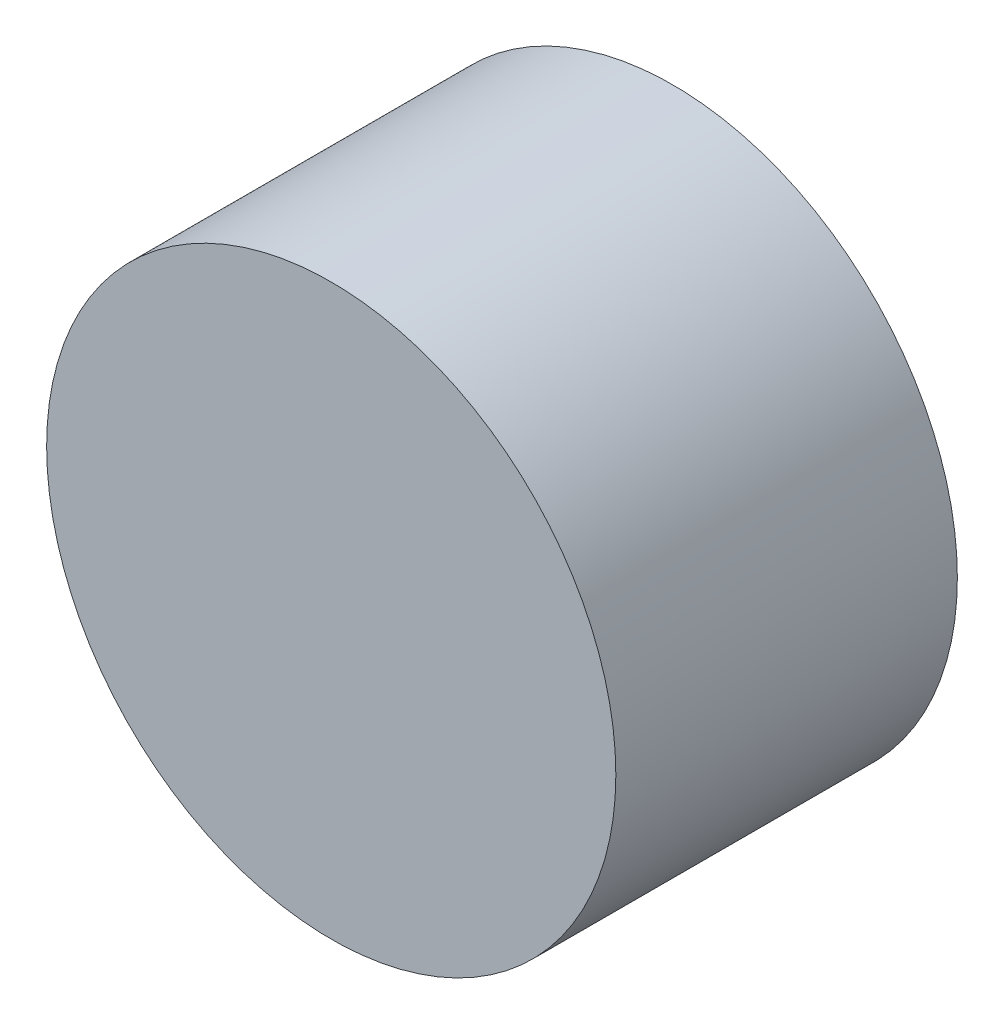
from build123d import *

# Parameters (mm, degrees)
SKETCH1_R           = 22.5
BOSS_EXTRUDE1_DEPTH = 27


with BuildPart() as part:
    # Sketch1 → Boss-Extrude1 (new body)
    with BuildSketch(Plane.XY):
        Circle(SKETCH1_R)
    extrude(amount=BOSS_EXTRUDE1_DEPTH)


solid = part.part
